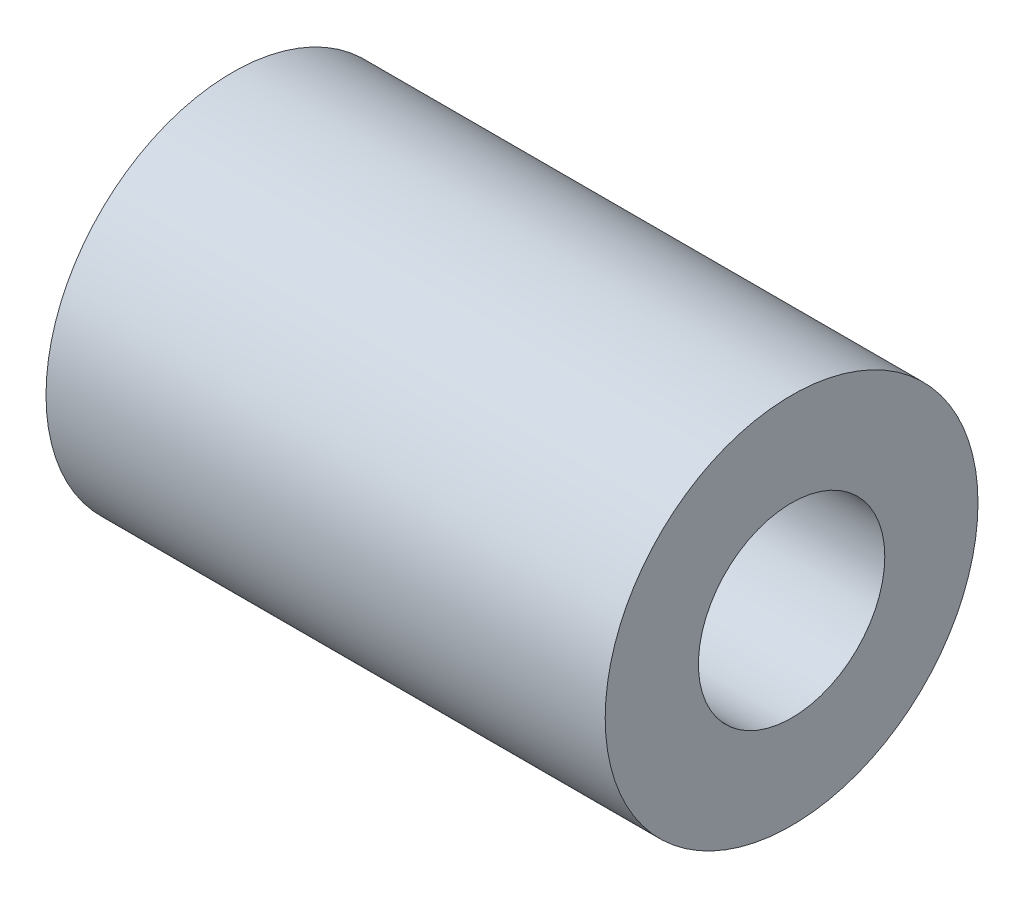
from build123d import *

# Parameters (mm, degrees)
SZKIC1_R                    = 5
SZKIC1_R_2                  = 2.5
DODANIE_WYCI_GNI_CIE1_DEPTH = 15


with BuildPart() as part:
    # Szkic1 → Dodanie-wyciągnięcie1 (new body)
    with BuildSketch(Plane(origin=(0, 0, 0), x_dir=(0, 0, -1), z_dir=(1, 0, 0))):
        Circle(SZKIC1_R)
        Circle(SZKIC1_R_2, mode=Mode.SUBTRACT)
    extrude(amount=DODANIE_WYCI_GNI_CIE1_DEPTH)


solid = part.part
